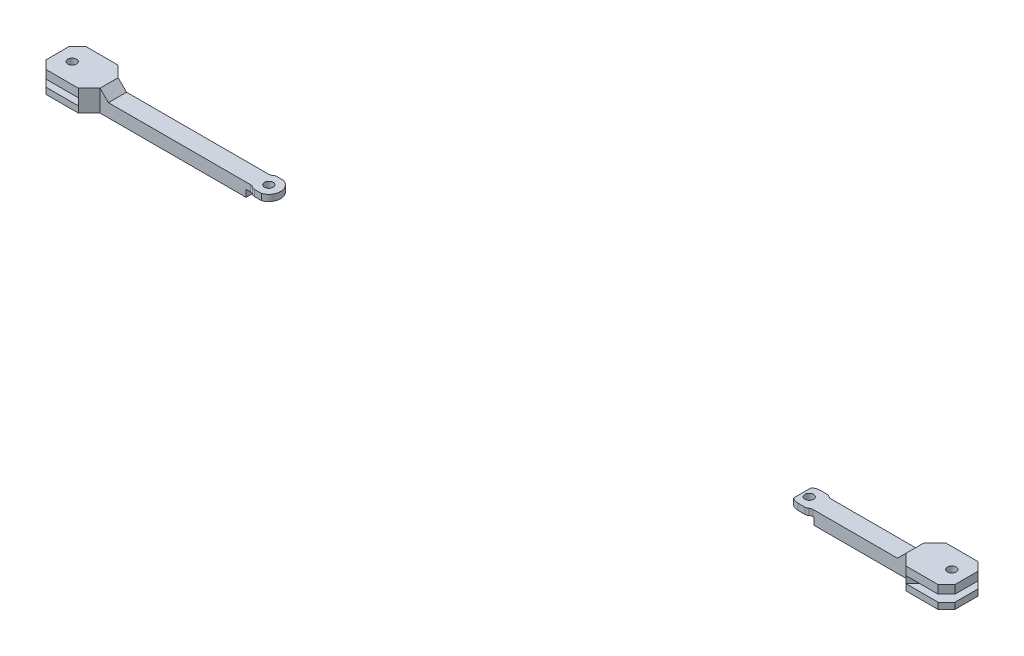
from build123d import *

# Parameters (mm, degrees)
SKETCH_577_R                   = 1.55
EXTRUDE_1486_DEPTH             = 2.25
EXTRUDE_1550_DEPTH             = 0.25
EXTRUDE_START                  = 0.25
SKETCH_3_R                     = 1.55
EXTRUDE_1865_DEPTH             = 2.25
EXTRUDE_START_2                = 5.5
SKETCH_5_R                     = 1.55
EXTRUDE_4_DEPTH                = 3
CHAMFER_1_SIZE                 = 3
CHAMFER_2_SIZE                 = 3
SKETCH_6_W                     = 8.98980632
SKETCH_6_H                     = 4.173657757
CUT_EXTRUDE_3129_DEPTH         = 164.375923072
SKETCH_4_2_W                   = 20.7
SKETCH_4_2_H                   = 6.5
SKETCH_4_2_R                   = 1.55
EXTRUDE_4092_DEPTH             = 2.25
EXTRUDE_4420_REACH             = 165.376
SKETCH_7_W                     = 19.4
SKETCH_7_H                     = 6.5
EXTRUDE_4420_DIRECTION_2_REACH = 165.376


with BuildPart() as part:
    # Sketch 577 → Extrude 1486 (new body)
    with BuildSketch(Plane(origin=(0, 0, 0), x_dir=(1, 0, 0), z_dir=(0, 1, 0))):
        Polygon((144.615729025, 3.25), (111.6, 3.25), (111.6, -3.25), (144.615729025, -3.25), (148.517618913, -7.151889887), (163.12661558, -7.151889887), (163.12661558, 7.151889887), (148.517618913, 7.151889887), align=None)
        with Locations(Location((157.87661558, 0, 0), (0, 0, 270))):
            Circle(SKETCH_577_R, mode=Mode.SUBTRACT)
    extrude(amount=-EXTRUDE_1486_DEPTH)

    # Sketch 4 → Extrude 1550 (add)
    with BuildSketch(Plane(origin=(0, 0, 0), x_dir=(1, 0, 0), z_dir=(0, 1, 0))):
        Polygon((144.615729025, 3.25), (111.6, 3.25), (111.6, -3.25), (144.615729025, -3.25), (148.517618913, -7.151889887), (153.376615581, -2.292893219), (153.376615581, 2.292893219), (148.517618913, 7.151889887), align=None)
    extrude(amount=EXTRUDE_1550_DEPTH)

    # 主结构-草图<3> → Extrude 1865 (add)
    with BuildSketch(Plane(origin=(0, 0, 0), x_dir=(1, 0, 0), z_dir=(0, 1, 0)).offset(EXTRUDE_START)):
        with BuildLine():
            ThreePointArc((111.35, 3.25), (110.733713943, 3.350009459), (110.180679422, 3.639773526))
            ThreePointArc((110.180679422, 3.639773526), (109.669568065, 3.907571827), (109.1, 4))
            Line((109.1, 4), (106.7, 4))
            ThreePointArc((106.7, 4), (105.40530494, 3.78467498), (104.25, 3.161882351))
            Line((104.25, 3.161882351), (104.25, -3.161882351))
            ThreePointArc((104.25, -3.161882351), (105.40530494, -3.78467498), (106.7, -4))
            Line((106.7, -4), (109.1, -4))
            ThreePointArc((109.1, -4), (109.669568065, -3.907571827), (110.180679422, -3.639773526))
            ThreePointArc((110.180679422, -3.639773526), (110.733713943, -3.350009459), (111.35, -3.25))
            Line((111.35, -3.25), (144.615729025, -3.25))
            Line((144.615729025, -3.25), (148.517618913, -7.151889887))
            Line((148.517618913, -7.151889887), (153.376615581, -2.292893219))
            Line((153.376615581, -2.292893219), (153.376615581, 2.292893219))
            Line((153.376615581, 2.292893219), (148.517618913, 7.151889887))
            Line((148.517618913, 7.151889887), (144.615729025, 3.25))
            Line((144.615729025, 3.25), (111.35, 3.25))
        make_face()
        with Locations(Location((106.7, 0, 0), (0, 0, 90))):
            Circle(SKETCH_3_R, mode=Mode.SUBTRACT)
    extrude(amount=EXTRUDE_1865_DEPTH)

    # 主结构-草图<5> → 凸台-拉伸4 (add)
    # profile 1 of 2: a face of its own
    with BuildSketch(Plane(origin=(0, 0, 0), x_dir=(1, 0, 0), z_dir=(0, 1, 0)).offset(EXTRUDE_START_2)):
        Polygon((144.615729025, 3.25), (148.517618913, 7.151889887), (153.376615581, 2.292893219), (153.376615581, -2.292893219), (148.517618913, -7.151889887), (144.615729025, -3.25), align=None)
    # profile 2 of 2: a face of its own
    with BuildSketch(Plane(origin=(0, 0, 0), x_dir=(1, 0, 0), z_dir=(0, 1, 0)).offset(EXTRUDE_START_2)):
        Polygon((163.12661558, -7.151889887), (148.517618913, -7.151889887), (153.376615581, -2.292893219), (153.376615581, 2.292893219), (148.517618913, 7.151889887), (163.12661558, 7.151889887), align=None)
        with Locations(Location((157.87661558, 0, 0), (0, 0, 270))):
            Circle(SKETCH_5_R, mode=Mode.SUBTRACT)
    extrude(amount=-EXTRUDE_4_DEPTH)

    # 倒角1
    # the kernel refuses this chamfer: 3 mm, written as the material it adds along each edge
    with BuildSketch(Plane(origin=(144.615729025, 2.5, 3.25), x_dir=(-0.9996219169112968, -0.027495876610586462, 0), z_dir=(0, 0, -1))) as chamfer_1_piece_1_section:
        Polygon((CHAMFER_1_SIZE * 0.999621916911, CHAMFER_1_SIZE * 0.0274958766106), (-CHAMFER_1_SIZE * 0.0274958766106, CHAMFER_1_SIZE * 0.999621916911), (0, 0), align=None)
    chamfer_1_piece_1 = extrude(amount=6.5, mode=Mode.PRIVATE)
    chamfer_1_piece_1 = split(chamfer_1_piece_1, bisect_by=Plane(origin=(143.442838303, 3.183373084, 2.077109278), z_dir=(-0.7071067811865577, 0, 0.7071067811865375)), keep=Keep.TOP, mode=Mode.PRIVATE)
    add(chamfer_1_piece_1)
    with BuildSketch(Plane(origin=(144.615729025, 2.5, 3.25), x_dir=(-0.9996219169112968, -0.027495876610586462, 0), z_dir=(0, 0, -1))) as chamfer_1_piece_2_section:
        Polygon((CHAMFER_1_SIZE * 0.999621916911, CHAMFER_1_SIZE * 0.0274958766106), (-CHAMFER_1_SIZE * 0.0274958766106, CHAMFER_1_SIZE * 0.999621916911), (0, 0), align=None)
    chamfer_1_piece_2 = extrude(amount=6.5, mode=Mode.PRIVATE)
    chamfer_1_piece_2 = split(chamfer_1_piece_2, bisect_by=Plane(origin=(142.621093837, 3.61900543, -1.255364812), z_dir=(0.7071067811865474, 0, 0.7071067811865477)), keep=Keep.TOP, mode=Mode.PRIVATE)
    chamfer_1_piece_2 = split(chamfer_1_piece_2, bisect_by=Plane(origin=(142.621093837, 3.61900543, 1.255364812), z_dir=(0.7071067811865577, 0, -0.7071067811865375)), keep=Keep.TOP, mode=Mode.PRIVATE)
    chamfer_1_piece_2 = split(chamfer_1_piece_2, bisect_by=Plane(origin=(143.876458648, 5.5, 0), z_dir=(0, -1, 0)), keep=Keep.TOP, mode=Mode.PRIVATE)
    add(chamfer_1_piece_2)
    with BuildSketch(Plane(origin=(144.615729025, 2.5, 3.25), x_dir=(-0.9996219169112968, -0.027495876610586462, 0), z_dir=(0, 0, -1))) as chamfer_1_piece_3_section:
        Polygon((CHAMFER_1_SIZE * 0.999621916911, CHAMFER_1_SIZE * 0.0274958766106), (-CHAMFER_1_SIZE * 0.0274958766106, CHAMFER_1_SIZE * 0.999621916911), (0, 0), align=None)
    chamfer_1_piece_3 = extrude(amount=6.5, mode=Mode.PRIVATE)
    chamfer_1_piece_3 = split(chamfer_1_piece_3, bisect_by=Plane(origin=(143.442838303, 3.183373084, -2.077109278), z_dir=(-0.7071067811865474, 0, -0.7071067811865477)), keep=Keep.TOP, mode=Mode.PRIVATE)
    add(chamfer_1_piece_3)

    # 倒角2
    chamfer_2_edges = [part.edges().sort_by_distance(p)[0] for p in [
        (163.12661558, -1.125, -7.151889887),
        (163.12661558, -1.125, 7.151889887),
        (163.12661558, 4, 7.151889887),
        (163.12661558, 4, -7.151889887),
    ]]
    chamfer(chamfer_2_edges, length=CHAMFER_2_SIZE)


with BuildPart() as body_2:
    # 镜向1: mirrored copy
    add(part.part.mirror(Plane(origin=(0, 0, 0), x_dir=(0, 0, 1), z_dir=(1, 0, 0))))

    # 草图6 → Cut-Extrude 3129 (cut, through all)
    with BuildSketch(Plane(origin=(0, 0, 0), x_dir=(1, 0, 0), z_dir=(0, 1, 0))):
        with Locations((-106.85509684, 5.336828879)):
            Rectangle(SKETCH_6_W, SKETCH_6_H)
        with Locations((-106.85509684, -5.336828879)):
            Rectangle(SKETCH_6_W, SKETCH_6_H)
    extrude(amount=CUT_EXTRUDE_3129_DEPTH, mode=Mode.SUBTRACT)

    # Sketch 4 2 → Extrude 4092 (add)
    # profile 1 of 2: a face of its own
    with BuildSketch(Plane(origin=(0, 0, 0), x_dir=(1, 0, 0), z_dir=(0, 1, 0)).offset(EXTRUDE_START)):
        with Locations((-101, 0)):
            Rectangle(SKETCH_4_2_W, SKETCH_4_2_H)
    # profile 2 of 2: a face of its own
    with BuildSketch(Plane(origin=(0, 0, 0), x_dir=(1, 0, 0), z_dir=(0, 1, 0)).offset(EXTRUDE_START)):
        with BuildLine():
            ThreePointArc((-85.981337923, 4.006159445), (-83.082396039, 0), (-85.981337923, -4.006159445))
            Line((-85.981337923, -4.006159445), (-88.381337923, -4.006159445))
            ThreePointArc((-88.381337923, -4.006159445), (-88.950452521, -3.917442693), (-89.462460405, -3.653605597))
            ThreePointArc((-89.462460405, -3.653605597), (-90.022874062, -3.35365813), (-90.65, -3.25))
            Line((-90.65, -3.25), (-90.65, 3.25))
            ThreePointArc((-90.65, 3.25), (-90.022874062, 3.35365813), (-89.462460405, 3.653605597))
            ThreePointArc((-89.462460405, 3.653605597), (-88.84075687, 3.95841575), (-88.15, 4.006159445))
            Line((-88.15, 4.006159445), (-85.981337923, 4.006159445))
        make_face()
        with Locations(Location((-87.3, 0, 0), (0, 0, 90))):
            Circle(SKETCH_4_2_R, mode=Mode.SUBTRACT)
    extrude(amount=EXTRUDE_4092_DEPTH)

    # 草图7 → Extrude 4420 (add, up to next)
    with BuildSketch(Plane(origin=(0, 0, 0), x_dir=(1, 0, 0), z_dir=(0, 1, 0)), mode=Mode.PRIVATE) as extrude_4420_sk1:
        with Locations((-101.9, 0)):
            Rectangle(SKETCH_7_W, SKETCH_7_H)
    extrude_4420_tool1 = extrude(extrude_4420_sk1.sketch, amount=EXTRUDE_4420_REACH, mode=Mode.PRIVATE) - body_2.part
    add(extrude_4420_tool1.solids().sort_by_distance((-101.9, 0, 0))[0])

    # Extrude 4420 direction 2: up to this face of the body (flat: up to its plane)
    extrude_4420_direction_2_end = Plane(body_2.part.faces().sort_by_distance((-141.556120838, -2.25, 0))[0])
    # 草图7 → Extrude 4420 direction 2 (add, up to the picked face)
    with BuildSketch(Plane(origin=(0, 0, 0), x_dir=(1, 0, 0), z_dir=(0, 1, 0)), mode=Mode.PRIVATE) as extrude_4420_direction_2_sk1:
        with Locations((-101.9, 0)):
            Rectangle(SKETCH_7_W, SKETCH_7_H)
    extrude_4420_direction_2_tool1 = split(extrude(extrude_4420_direction_2_sk1.sketch, amount=-EXTRUDE_4420_DIRECTION_2_REACH, mode=Mode.PRIVATE), bisect_by=extrude_4420_direction_2_end, keep=Keep.BOTH, mode=Mode.PRIVATE)
    add(extrude_4420_direction_2_tool1.solids().sort_by(Axis((-101.9, 0, 0), (0, -1, 0)))[0])


solid = Compound([part.part, body_2.part])
